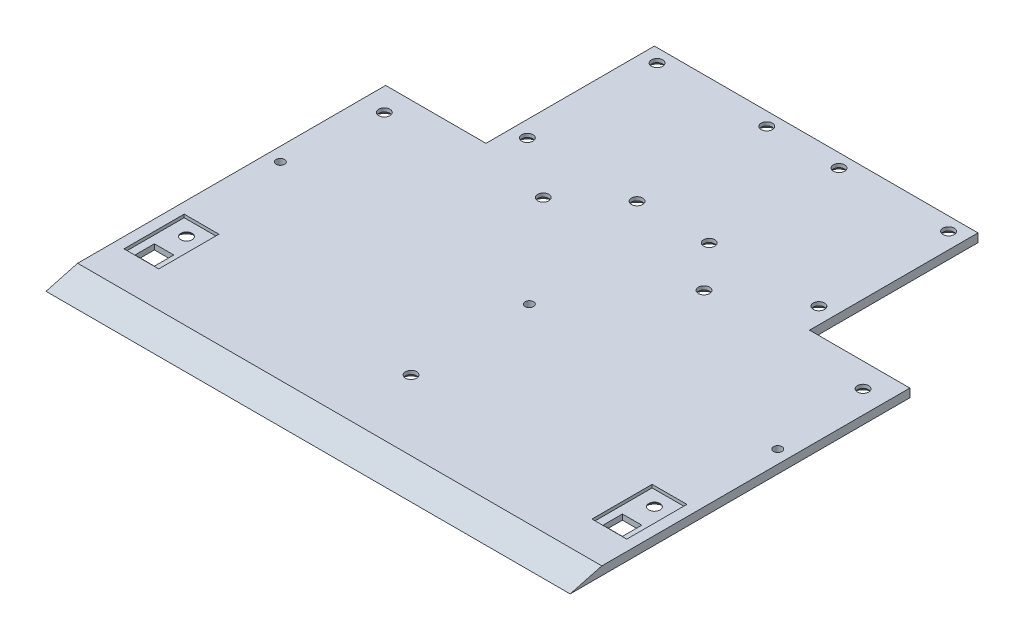
from build123d import *

# Parameters (mm, degrees)
SALIENTE_EXTRUIR1_DEPTH                              = 196
CORTAR_EXTRUIR1_REACH                                = 274.995
CROQUIS2_W                                           = 37.5
CROQUIS2_H                                           = 62.989872981
CROQUIS3_W                                           = 13
CROQUIS3_H                                           = 22.5
CORTAR_EXTRUIR2_DEPTH                                = 1.17
CORTAR_EXTRUIR3_REACH                                = 274.984
CROQUIS5_W                                           = 7.25
CROQUIS5_H                                           = 7.25
CORTAR_EXTRUIR4_REACH                                = 274.984
CROQUIS6_R                                           = 1.6
CUT_EXTRUDE1_REACH                                   = 274.995
SKETCH1_R                                            = 1.585
CUT_EXTRUDE2_REACH                                   = 274.995
SKETCH2_R                                            = 1.585
CUT_EXTRUDE3_REACH                                   = 274.995
SKETCH3_R                                            = 1.579889923
SKETCH3_R_2                                          = 1.585
SKETCH4_R                                            = 1.6
CUT_EXTRUDE4_DEPTH                                   = 4.9
AVELLANADO_PARA_TORNILLO_CON_CABEZA_AVEL_D           = 4.2
AVELLANADO_PARA_TORNILLO_CON_CABEZA_AVEL_DEPTH       = 10
AVELLANADO_PARA_TORNILLO_CON_CABEZA_AVEL_CSINK_D     = 8
AVELLANADO_PARA_TORNILLO_CON_CABEZA_AVEL_CSINK_ANGLE = 92
AVELLANADO_PARA_TORNILLO_CON_CABEZA_AVEL_TIP         = 1.2618073
SKETCH6_R                                            = 1.585
CUT_EXTRUDE5_DEPTH                                   = 10


with BuildPart() as part:
    # Croquis1 → Saliente-Extruir1 (new body)
    with BuildSketch(Plane(origin=(0, 0, 0), x_dir=(0, 0, -1), z_dir=(1, 0, 0))):
        Polygon((0, 0), (190, 0), (190, 3.17), (11.83060106, 3.17), align=None)
    extrude(amount=SALIENTE_EXTRUIR1_DEPTH)

    # Croquis2 → Cortar-Extruir1 (cut, up to next)
    with BuildSketch(Plane(origin=(0, 0, 0), x_dir=(-1, 0, 0), z_dir=(0, -1, 0)), mode=Mode.PRIVATE) as cortar_extruir1_sk1:
        with Locations((-18.75, 158.50506351)):
            Rectangle(CROQUIS2_W, CROQUIS2_H)
    cortar_extruir1_tool1 = extrude(cortar_extruir1_sk1.sketch, amount=-CORTAR_EXTRUIR1_REACH, mode=Mode.PRIVATE) & part.part
    cortar_extruir1 = cortar_extruir1_tool1.solids().sort_by_distance((18.75, 0, -158.505064))[0]
    add(cortar_extruir1, mode=Mode.SUBTRACT)

    # Simetría1: Cortar-Extruir1 across plane
    add(cortar_extruir1.mirror(Plane.ZY.offset(-98)), mode=Mode.SUBTRACT)

    # Croquis3 → Cortar-Extruir2 (cut)
    with BuildSketch(Plane(origin=(0, 3.17, 0), x_dir=(1, 0, 0), z_dir=(0, 1, 0))):
        with Locations((10.5, 36.41)):
            Rectangle(CROQUIS3_W, CROQUIS3_H)
    cortar_extruir2 = extrude(amount=-CORTAR_EXTRUIR2_DEPTH, mode=Mode.SUBTRACT)

    # Croquis5 → Cortar-Extruir3 (cut, up to next)
    with BuildSketch(Plane(origin=(0, 2, 0), x_dir=(1, 0, 0), z_dir=(0, 1, 0)), mode=Mode.PRIVATE) as cortar_extruir3_sk1:
        with Locations((10.5, 30.035)):
            Rectangle(CROQUIS5_W, CROQUIS5_H)
    cortar_extruir3_tool1 = extrude(cortar_extruir3_sk1.sketch, amount=-CORTAR_EXTRUIR3_REACH, mode=Mode.PRIVATE) & part.part
    cortar_extruir3 = cortar_extruir3_tool1.solids().sort_by_distance((10.5, 2, -30.035))[0]
    add(cortar_extruir3, mode=Mode.SUBTRACT)

    # Croquis6 → Cortar-Extruir4 (cut, up to next)
    with BuildSketch(Plane(origin=(0, 2, 0), x_dir=(1, 0, 0), z_dir=(0, 1, 0)), mode=Mode.PRIVATE) as cortar_extruir4_sk1:
        with Locations((10.5, 42.01)):
            Circle(CROQUIS6_R)
    cortar_extruir4_tool1 = extrude(cortar_extruir4_sk1.sketch, amount=-CORTAR_EXTRUIR4_REACH, mode=Mode.PRIVATE) & part.part
    cortar_extruir4 = cortar_extruir4_tool1.solids().sort_by_distance((10.5, 2, -42.01))[0]
    add(cortar_extruir4, mode=Mode.SUBTRACT)

    # Simetría2: Cortar-Extruir2, Cortar-Extruir3, Cortar-Extruir4 across plane
    add(cortar_extruir2.mirror(Plane.ZY.offset(-98)), mode=Mode.SUBTRACT)
    add(cortar_extruir3.mirror(Plane.ZY.offset(-98)), mode=Mode.SUBTRACT)
    add(cortar_extruir4.mirror(Plane.ZY.offset(-98)), mode=Mode.SUBTRACT)

    # Sketch1 → Cut-Extrude1 (cut, up to next)
    with BuildSketch(Plane(origin=(0, 3.17, 0), x_dir=(1, 0, 0), z_dir=(0, 1, 0)), mode=Mode.PRIVATE) as cut_extrude1_sk1:
        with Locations((8.5, 118.010127019)):
            Circle(SKETCH1_R)
    cut_extrude1_tool1 = extrude(cut_extrude1_sk1.sketch, amount=-CUT_EXTRUDE1_REACH, mode=Mode.PRIVATE) & part.part
    # Sketch1 → Cut-Extrude1 (cut, up to next)
    with BuildSketch(Plane(origin=(0, 3.17, 0), x_dir=(1, 0, 0), z_dir=(0, 1, 0)), mode=Mode.PRIVATE) as cut_extrude1_sk2:
        with Locations((187.5, 118.010127019)):
            Circle(SKETCH1_R)
    cut_extrude1_tool2 = extrude(cut_extrude1_sk2.sketch, amount=-CUT_EXTRUDE1_REACH, mode=Mode.PRIVATE) & part.part
    add(cut_extrude1_tool1.solids().sort_by_distance((8.5, 3.17, -118.010127))[0], mode=Mode.SUBTRACT)
    add(cut_extrude1_tool2.solids().sort_by_distance((187.5, 3.17, -118.010127))[0], mode=Mode.SUBTRACT)

    # Sketch2 → Cut-Extrude2 (cut, up to next)
    with BuildSketch(Plane(origin=(0, 3.17, 0), x_dir=(1, 0, 0), z_dir=(0, 1, 0)), mode=Mode.PRIVATE) as cut_extrude2_sk1:
        with Locations((98.5, 38.010127019)):
            Circle(SKETCH2_R)
    cut_extrude2_tool1 = extrude(cut_extrude2_sk1.sketch, amount=-CUT_EXTRUDE2_REACH, mode=Mode.PRIVATE) & part.part
    add(cut_extrude2_tool1.solids().sort_by_distance((98.5, 3.17, -38.010127))[0], mode=Mode.SUBTRACT)

    # Sketch3 → Cut-Extrude3 (cut, up to next)
    with BuildSketch(Plane(origin=(0, 3.17, 0), x_dir=(1, 0, 0), z_dir=(0, 1, 0)), mode=Mode.PRIVATE) as cut_extrude3_sk1:
        with Locations((43.5, 185)):
            Circle(SKETCH3_R)
    cut_extrude3_tool1 = extrude(cut_extrude3_sk1.sketch, amount=-CUT_EXTRUDE3_REACH, mode=Mode.PRIVATE) & part.part
    # Sketch3 → Cut-Extrude3 (cut, up to next)
    with BuildSketch(Plane(origin=(0, 3.17, 0), x_dir=(1, 0, 0), z_dir=(0, 1, 0)), mode=Mode.PRIVATE) as cut_extrude3_sk2:
        with Locations((84.5, 185)):
            Circle(SKETCH3_R_2)
    cut_extrude3_tool2 = extrude(cut_extrude3_sk2.sketch, amount=-CUT_EXTRUDE3_REACH, mode=Mode.PRIVATE) & part.part
    # Sketch3 → Cut-Extrude3 (cut, up to next)
    with BuildSketch(Plane(origin=(0, 3.17, 0), x_dir=(1, 0, 0), z_dir=(0, 1, 0)), mode=Mode.PRIVATE) as cut_extrude3_sk3:
        with Locations((152.5, 185)):
            Circle(SKETCH3_R_2)
    cut_extrude3_tool3 = extrude(cut_extrude3_sk3.sketch, amount=-CUT_EXTRUDE3_REACH, mode=Mode.PRIVATE) & part.part
    # Sketch3 → Cut-Extrude3 (cut, up to next)
    with BuildSketch(Plane(origin=(0, 3.17, 0), x_dir=(1, 0, 0), z_dir=(0, 1, 0)), mode=Mode.PRIVATE) as cut_extrude3_sk4:
        with Locations((111.5, 185)):
            Circle(SKETCH3_R_2)
    cut_extrude3_tool4 = extrude(cut_extrude3_sk4.sketch, amount=-CUT_EXTRUDE3_REACH, mode=Mode.PRIVATE) & part.part
    # Sketch3 → Cut-Extrude3 (cut, up to next)
    with BuildSketch(Plane(origin=(0, 3.17, 0), x_dir=(1, 0, 0), z_dir=(0, 1, 0)), mode=Mode.PRIVATE) as cut_extrude3_sk5:
        with Locations((111.5, 136.5)):
            Circle(SKETCH3_R_2)
    cut_extrude3_tool5 = extrude(cut_extrude3_sk5.sketch, amount=-CUT_EXTRUDE3_REACH, mode=Mode.PRIVATE) & part.part
    # Sketch3 → Cut-Extrude3 (cut, up to next)
    with BuildSketch(Plane(origin=(0, 3.17, 0), x_dir=(1, 0, 0), z_dir=(0, 1, 0)), mode=Mode.PRIVATE) as cut_extrude3_sk6:
        with Locations((152.5, 136.5)):
            Circle(SKETCH3_R_2)
    cut_extrude3_tool6 = extrude(cut_extrude3_sk6.sketch, amount=-CUT_EXTRUDE3_REACH, mode=Mode.PRIVATE) & part.part
    # Sketch3 → Cut-Extrude3 (cut, up to next)
    with BuildSketch(Plane(origin=(0, 3.17, 0), x_dir=(1, 0, 0), z_dir=(0, 1, 0)), mode=Mode.PRIVATE) as cut_extrude3_sk7:
        with Locations((84.5, 136.5)):
            Circle(SKETCH3_R_2)
    cut_extrude3_tool7 = extrude(cut_extrude3_sk7.sketch, amount=-CUT_EXTRUDE3_REACH, mode=Mode.PRIVATE) & part.part
    # Sketch3 → Cut-Extrude3 (cut, up to next)
    with BuildSketch(Plane(origin=(0, 3.17, 0), x_dir=(1, 0, 0), z_dir=(0, 1, 0)), mode=Mode.PRIVATE) as cut_extrude3_sk8:
        with Locations((43.5, 136.5)):
            Circle(SKETCH3_R_2)
    cut_extrude3_tool8 = extrude(cut_extrude3_sk8.sketch, amount=-CUT_EXTRUDE3_REACH, mode=Mode.PRIVATE) & part.part
    add(cut_extrude3_tool1.solids().sort_by_distance((43.5, 3.17, -185))[0], mode=Mode.SUBTRACT)
    add(cut_extrude3_tool2.solids().sort_by_distance((84.5, 3.17, -185))[0], mode=Mode.SUBTRACT)
    add(cut_extrude3_tool3.solids().sort_by_distance((152.5, 3.17, -185))[0], mode=Mode.SUBTRACT)
    add(cut_extrude3_tool4.solids().sort_by_distance((111.5, 3.17, -185))[0], mode=Mode.SUBTRACT)
    add(cut_extrude3_tool5.solids().sort_by_distance((111.5, 3.17, -136.5))[0], mode=Mode.SUBTRACT)
    add(cut_extrude3_tool6.solids().sort_by_distance((152.5, 3.17, -136.5))[0], mode=Mode.SUBTRACT)
    add(cut_extrude3_tool7.solids().sort_by_distance((84.5, 3.17, -136.5))[0], mode=Mode.SUBTRACT)
    add(cut_extrude3_tool8.solids().sort_by_distance((43.5, 3.17, -136.5))[0], mode=Mode.SUBTRACT)

    # Sketch4 → Cut-Extrude4 (cut)
    with BuildSketch(Plane(origin=(0, 3.17, 0), x_dir=(1, 0, 0), z_dir=(0, 1, 0))):
        with Locations((65.776416732, 120.166862559)):
            Circle(SKETCH4_R)
        with Locations((125.876416732, 120.166862559)):
            Circle(SKETCH4_R)
    extrude(amount=-CUT_EXTRUDE4_DEPTH, mode=Mode.SUBTRACT)

    # Avellanado para tornillo con cabeza avellanada en cruz de M3.51
    with Locations(Plane(origin=(187.5, 0, -118.010127019), x_dir=(0, 0, -1), z_dir=(0, -1, 0))):
        with Locations((0, 0), (18.489872981, -35), (2.15673554, -61.623583268), (18.489872981, -76), (18.489872981, -103), (2.15673554, -121.723583268), (18.489872981, -144), (0, -179), (66.989872981, -144), (66.989872981, -103), (66.989872981, -76), (66.989872981, -35), (-76.000127019, -177), (-80, -89), (-76.000127019, -2)):
            CounterSinkHole(AVELLANADO_PARA_TORNILLO_CON_CABEZA_AVEL_D / 2, AVELLANADO_PARA_TORNILLO_CON_CABEZA_AVEL_CSINK_D / 2, depth=AVELLANADO_PARA_TORNILLO_CON_CABEZA_AVEL_DEPTH, counter_sink_angle=AVELLANADO_PARA_TORNILLO_CON_CABEZA_AVEL_CSINK_ANGLE)
            with Locations((0, 0, -(AVELLANADO_PARA_TORNILLO_CON_CABEZA_AVEL_DEPTH + AVELLANADO_PARA_TORNILLO_CON_CABEZA_AVEL_TIP / 2))):  # 118° drill point
                Cone(0, AVELLANADO_PARA_TORNILLO_CON_CABEZA_AVEL_D / 2, AVELLANADO_PARA_TORNILLO_CON_CABEZA_AVEL_TIP, mode=Mode.SUBTRACT)

    # Sketch6 → Cut-Extrude5 (cut)
    with BuildSketch(Plane(origin=(0, 3.17, 0), x_dir=(1, 0, 0), z_dir=(0, 1, 0))):
        with Locations((191.067111952, 82.557811806)):
            Circle(SKETCH6_R)
        with Locations((97.681935477, 83.038529763)):
            Circle(SKETCH6_R)
        with Locations((5.067111952, 82.557811806)):
            Circle(SKETCH6_R)
    extrude(amount=-CUT_EXTRUDE5_DEPTH, mode=Mode.SUBTRACT)


solid = part.part
